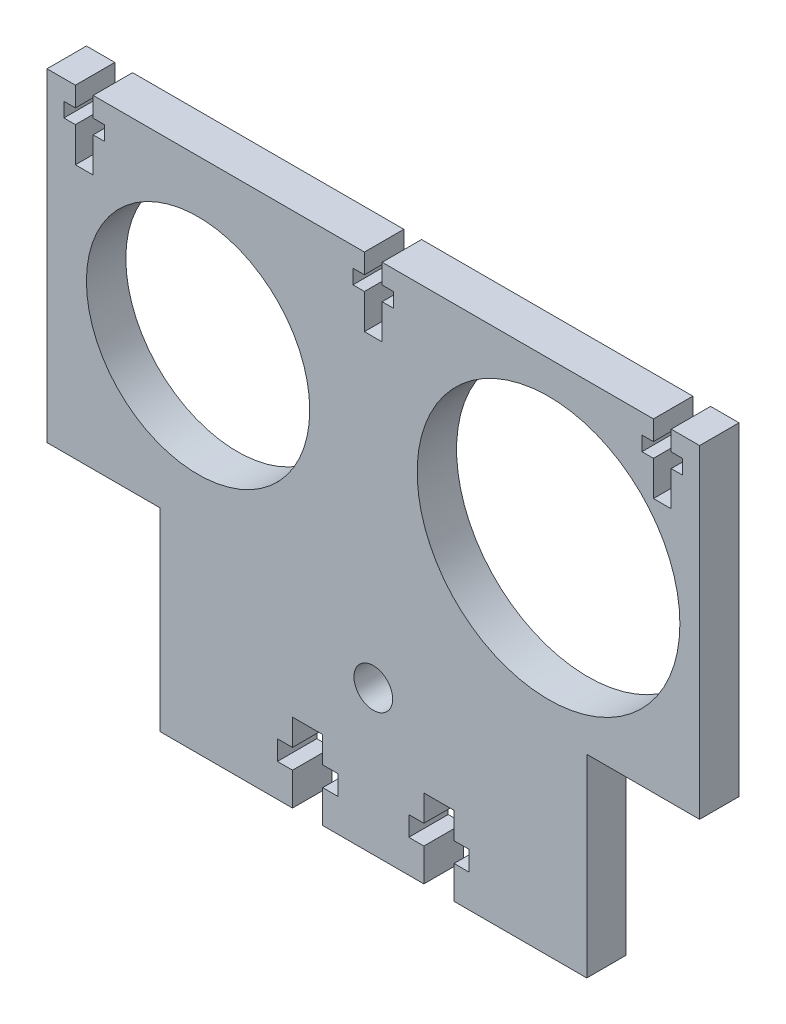
from build123d import *

# Parameters (mm, degrees)
SKETCH1_R           = 2.95
SKETCH1_R_2         = 17
SKETCH1_R_3         = 20
BOSS_EXTRUDE1_DEPTH = 6
CUT_EXTRUDE2_DEPTH  = 76.689323992
CUT_EXTRUDE3_DEPTH  = 76.689323992


with BuildPart() as part:
    # Sketch1 → Boss-Extrude1 (new body)
    with BuildSketch(Plane.XY):
        Polygon((-32.5, 7.5), (-32.5, -22), (32.5, -22), (32.5, 7.5), (49.675685802, 7.5), (49.675685802, 56.790844389), (-49.675685802, 56.790844389), (-49.675685802, 7.5), align=None)
        Circle(SKETCH1_R, mode=Mode.SUBTRACT)
        with Locations((-26.675685802, 31.790844389)):
            Circle(SKETCH1_R_2, mode=Mode.SUBTRACT)
        with Locations((26.675685802, 31.790844389)):
            Circle(SKETCH1_R_3, mode=Mode.SUBTRACT)
    extrude(amount=BOSS_EXTRUDE1_DEPTH)

    # Sketch3 → Cut-Extrude2 (cut, through all)
    with BuildSketch(Plane.XY.offset(6)):
        Polygon((-12.3, -22), (-7.7, -22), (-7.7, -17), (-5.4, -17), (-5.4, -14), (-7.7, -14), (-7.7, -10), (-12.3, -10), (-12.3, -14), (-14.6, -14), (-14.6, -17), (-12.3, -17), align=None)
        Polygon((7.7, -14), (7.7, -10), (12.3, -10), (12.3, -14), (14.6, -14), (14.6, -17), (12.3, -17), (12.3, -22), (7.7, -22), (7.7, -17), (5.4, -17), (5.4, -14), align=None)
    extrude(amount=-CUT_EXTRUDE2_DEPTH, mode=Mode.SUBTRACT)

    # Sketch4 → Cut-Extrude3 (cut, through all)
    with BuildSketch(Plane.XY.offset(6)):
        Polygon((42.65, 56.790844389), (42.65, 53.790844389), (40.9, 53.790844389), (40.9, 51.590844389), (42.65, 51.590844389), (42.65, 46.290844389), (45.35, 46.290844389), (45.35, 51.590844389), (47.1, 51.590844389), (47.1, 53.790844389), (45.35, 53.790844389), (45.35, 56.790844389), align=None)
        Polygon((-45.35, 56.790844389), (-42.65, 56.790844389), (-42.65, 53.790844389), (-40.9, 53.790844389), (-40.9, 51.590844389), (-42.65, 51.590844389), (-42.65, 46.290844389), (-45.35, 46.290844389), (-45.35, 51.590844389), (-47.1, 51.590844389), (-47.1, 53.790844389), (-45.35, 53.790844389), align=None)
        Polygon((-1.35, 56.790844389), (1.35, 56.790844389), (1.35, 53.790844389), (3.1, 53.790844389), (3.1, 51.590844389), (1.35, 51.590844389), (1.35, 46.290844389), (-1.35, 46.290844389), (-1.35, 51.590844389), (-3.1, 51.590844389), (-3.1, 53.790844389), (-1.35, 53.790844389), align=None)
    extrude(amount=-CUT_EXTRUDE3_DEPTH, mode=Mode.SUBTRACT)


solid = part.part
